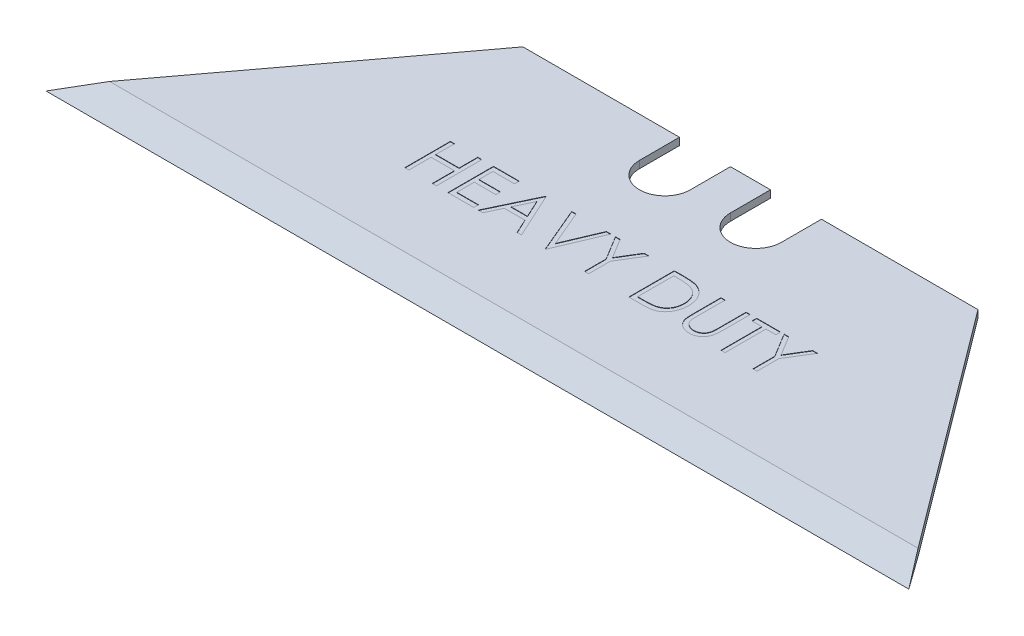
from build123d import *

# Parameters (mm, degrees)
BOSS_EXTRUDE1_DEPTH = 0.254
CUT_EXTRUDE1_DEPTH  = 33.584623434
CUT_EXTRUDE2_DEPTH  = 33.58165337
CUT_EXTRUDE3_DEPTH  = 0.0254


with BuildPart() as part:
    # Sketch1 → Boss-Extrude1 (new, symmetric)
    with BuildSketch(Plane(origin=(0, 0, 0), x_dir=(1, 0, 0), z_dir=(0, 1, 0))):
        Polygon((-15.875, 6.578038674), (-30.099, -12.471961326), (30.099, -12.471961326), (15.875, 6.578038674), align=None)
    extrude(amount=BOSS_EXTRUDE1_DEPTH, both=True)

    # Sketch2 → Cut-Extrude1 (cut, through all)
    with BuildSketch(Plane(origin=(0, 0.254, 0), x_dir=(1, 0, 0), z_dir=(0, 1, 0))):
        with BuildLine():
            Line((-4.953, 3.784038674), (-4.953, 6.578038674))
            Line((-4.953, 6.578038674), (-1.397, 6.578038674))
            Line((-1.397, 6.578038674), (-1.397, 3.784038674))
            ThreePointArc((-1.397, 3.784038674), (-3.175, 2.006038674), (-4.953, 3.784038674))
        make_face()
        with BuildLine():
            Line((1.397, 3.784038674), (1.397, 6.578038674))
            Line((1.397, 6.578038674), (4.953, 6.578038674))
            Line((4.953, 6.578038674), (4.953, 3.784038674))
            ThreePointArc((4.953, 3.784038674), (3.175, 2.006038674), (1.397, 3.784038674))
        make_face()
    extrude(amount=-CUT_EXTRUDE1_DEPTH, mode=Mode.SUBTRACT)

    # Sketch3 → Cut-Extrude2 (cut, symmetric)
    with BuildSketch(Plane(origin=(0, 0, 0), x_dir=(0, 0, -1), z_dir=(1, 0, 0))):
        Polygon((-12.471961326, 0), (-9.931961326, 0.254), (-12.471961326, 0.254), align=None)
    cut_extrude2 = extrude(amount=CUT_EXTRUDE2_DEPTH, both=True, mode=Mode.SUBTRACT)

    # Mirror1: Cut-Extrude2 across plane
    add(cut_extrude2.mirror(Plane.ZX), mode=Mode.SUBTRACT)

    # Sketch4 → Cut-Extrude3 (cut)
    # profile 1 of 9: a face of its own
    with BuildSketch(Plane(origin=(0, 0.254, 0), x_dir=(1, 0, 0), z_dir=(0, 1, 0))):
        Polygon((-12.694002001, -1.667291369), (-12.409066104, -1.667291369), (-12.409066104, -2.969855472), (-10.780860975, -2.969855472), (-10.780860975, -1.667291369), (-10.495925078, -1.667291369), (-10.495925078, -4.842291369), (-10.780860975, -4.842291369), (-10.780860975, -3.295496498), (-12.409066104, -3.295496498), (-12.409066104, -4.842291369), (-12.694002001, -4.842291369), align=None)
    # profile 2 of 9: a face of its own
    with BuildSketch(Plane(origin=(0, 0.254, 0), x_dir=(1, 0, 0), z_dir=(0, 1, 0))):
        Polygon((-9.681822514, -1.667291369), (-7.890796873, -1.667291369), (-7.890796873, -1.992932395), (-9.396886616, -1.992932395), (-9.396886616, -2.969855472), (-7.890796873, -2.969855472), (-7.890796873, -3.295496498), (-9.396886616, -3.295496498), (-9.396886616, -4.516650344), (-7.890796873, -4.516650344), (-7.890796873, -4.842291369), (-9.681822514, -4.842291369), align=None)
    # profile 3 of 9: a face of its own
    with BuildSketch(Plane(origin=(0, 0.254, 0), x_dir=(1, 0, 0), z_dir=(0, 1, 0))):
        Polygon((-6.018360975, -1.667291369), (-4.55297636, -4.842291369), (-4.862716945, -4.842291369), (-5.332097955, -3.824663164), (-6.771405847, -3.824663164), (-7.254143227, -4.842291369), (-7.565155847, -4.842291369), (-6.059066104, -1.667291369), align=None)
        Polygon((-6.041893628, -2.286136522), (-6.616853564, -3.499022139), (-5.482198115, -3.499022139), align=None, mode=Mode.SUBTRACT)
    # profile 4 of 9: a face of its own
    with BuildSketch(Plane(origin=(0, 0.254, 0), x_dir=(1, 0, 0), z_dir=(0, 1, 0))):
        Polygon((-4.227335334, -1.667291369), (-3.922046873, -1.667291369), (-2.86371354, -4.169384719), (-1.805380206, -1.667291369), (-1.500091745, -1.667291369), (-2.843360975, -4.842291369), (-2.884066104, -4.842291369), align=None)
    # profile 5 of 9: a face of its own
    with BuildSketch(Plane(origin=(0, 0.254, 0), x_dir=(1, 0, 0), z_dir=(0, 1, 0))):
        Polygon((-1.174450719, -1.667291369), (-0.848173676, -1.667291369), (-0.013718548, -3.031549182), (0.819464545, -1.667291369), (1.145741589, -1.667291369), (0.128113384, -3.333021538), (0.128113384, -4.842291369), (-0.156822514, -4.842291369), (-0.156822514, -3.333021538), align=None)
    # profile 6 of 9: a face of its own
    with BuildSketch(Plane(origin=(0, 0.254, 0), x_dir=(1, 0, 0), z_dir=(0, 1, 0))):
        with BuildLine():
            Line((2.93676723, -4.842291369), (2.93676723, -1.667291369))
            Line((2.93676723, -1.667291369), (3.577872999, -1.667291369))
            add(Edge.make_bspline(
                [(3.577872999, -1.667291369), (3.633634153, -1.667692844), (3.741364411, -1.66846849), (3.897041417, -1.673386466), (4.041080973, -1.682086389), (4.173009352, -1.694758744), (4.293188737, -1.710318996), (4.401282618, -1.729822935), (4.497849919, -1.752853632), (4.557240054, -1.772489148), (4.585324922, -1.781774543)],
                knots=[0, 0, 0, 0, 1.314313732, 2.53924729, 3.670748893, 4.714932338, 5.66265055, 6.526160246, 7.303039223, 8, 8, 8, 8], degree=3))
            add(Edge.make_bspline(
                [(4.585324922, -1.781774543), (4.622059436, -1.795772397), (4.694695446, -1.823450681), (4.798116193, -1.875662469), (4.895475629, -1.934820068), (4.987295853, -2.001001458), (5.07147946, -2.076080545), (5.151315195, -2.156868044), (5.223537123, -2.246301753), (5.289675363, -2.342526921), (5.349306997, -2.444409997), (5.401140376, -2.551756845), (5.444187927, -2.664022312), (5.479923211, -2.780894197), (5.508086783, -2.902629482), (5.527301821, -3.029369918), (5.539975505, -3.160614611), (5.54124918, -3.249672875), (5.541895435, -3.29486048)],
                knots=[0, 0, 0, 0, 0.984719456, 1.947108742, 2.898477687, 3.838006223, 4.779231079, 5.722358779, 6.681677486, 7.655904652, 8.64651281, 9.637519902, 10.640069247, 11.656948941, 12.698408672, 13.768548281, 14.867775369, 16, 16, 16, 16], degree=3))
            add(Edge.make_bspline(
                [(5.541895435, -3.29486048), (5.541324871, -3.334104604), (5.540200517, -3.411439248), (5.530104637, -3.525413489), (5.515430404, -3.636006514), (5.492711739, -3.742691685), (5.465132316, -3.846403711), (5.429786265, -3.946037247), (5.389295493, -4.042506274), (5.342078817, -4.134506413), (5.290243418, -4.221667758), (5.234615837, -4.303832701), (5.175255406, -4.379828795), (5.111596082, -4.449886179), (5.044460511, -4.51389924), (4.973409154, -4.572402711), (4.898258672, -4.624251871), (4.819345659, -4.671484176), (4.734368028, -4.712686927), (4.641716206, -4.747548436), (4.540995066, -4.776437866), (4.432451834, -4.800541464), (4.315898965, -4.819661589), (4.191222188, -4.832476245), (4.058613061, -4.84114212), (3.967554728, -4.841900848), (3.920686501, -4.842291369)],
                knots=[0, 0, 0, 0, 1.105936401, 2.179363191, 3.223086493, 4.248585256, 5.251745608, 6.245858792, 7.225916811, 8.198733463, 9.158002045, 10.082870192, 10.993790845, 11.873723703, 12.748670949, 13.606408763, 14.465103618, 15.319838547, 16.196477973, 17.123216899, 18.106603292, 19.147568657, 20.255746949, 21.433717677, 22.679120308, 24, 24, 24, 24], degree=3))
            Line((3.920686501, -4.842291369), (2.93676723, -4.842291369))
        make_face()
        with BuildLine():
            Line((3.221703127, -4.516650344), (3.586141228, -4.516650344))
            add(Edge.make_bspline(
                [(3.586141228, -4.516650344), (3.638509107, -4.516425285), (3.739231717, -4.515992414), (3.884064329, -4.512194023), (4.016397782, -4.505987408), (4.136250865, -4.497301445), (4.243555909, -4.485809201), (4.338537167, -4.472995896), (4.420883295, -4.457032495), (4.470712141, -4.442562696), (4.493738384, -4.435876105)],
                knots=[0, 0, 0, 0, 1.375205317, 2.645023457, 3.804390687, 4.853969522, 5.800190428, 6.637939096, 7.370582563, 8, 8, 8, 8], degree=3))
            add(Edge.make_bspline(
                [(4.493738384, -4.435876105), (4.522720112, -4.425669334), (4.579991341, -4.405499581), (4.662433468, -4.368707989), (4.73932018, -4.325126968), (4.811991417, -4.276683477), (4.879416311, -4.221668889), (4.942393903, -4.161279492), (5.000797394, -4.095207947), (5.054023373, -4.023536257), (5.101655906, -3.946710514), (5.142904807, -3.865486001), (5.179055839, -3.78075268), (5.207429991, -3.691209372), (5.229669128, -3.597656583), (5.245421381, -3.500087732), (5.255231881, -3.398521041), (5.256376194, -3.329440185), (5.256959537, -3.294224462)],
                knots=[0, 0, 0, 0, 0.998632004, 1.973411704, 2.929992603, 3.868527914, 4.809262121, 5.754881198, 6.702106254, 7.672490631, 8.653608572, 9.636854334, 10.631411391, 11.644891563, 12.686317036, 13.754757253, 14.855430412, 16, 16, 16, 16], degree=3))
            add(Edge.make_bspline(
                [(5.256959537, -3.294224462), (5.256493912, -3.257091948), (5.255579188, -3.184144795), (5.244081778, -3.077110379), (5.227280081, -2.974167217), (5.202983452, -2.875308426), (5.172021869, -2.780341135), (5.133382444, -2.689790579), (5.089234868, -2.602700448), (5.036708269, -2.521080845), (4.979181267, -2.443889239), (4.915338476, -2.373172994), (4.846194198, -2.308771021), (4.772502585, -2.249680359), (4.692186788, -2.19827831), (4.607138797, -2.15229825), (4.516110938, -2.113276691), (4.45278085, -2.092522294), (4.420596356, -2.081974863)],
                knots=[0, 0, 0, 0, 1.122418816, 2.205001699, 3.251619955, 4.274784885, 5.280384055, 6.268708349, 7.249350384, 8.229342522, 9.199999885, 10.157847722, 11.105861043, 12.055065948, 13.010012805, 13.98527497, 14.976112212, 16, 16, 16, 16], degree=3))
            add(Edge.make_bspline(
                [(4.420596356, -2.081974863), (4.393970674, -2.074612103), (4.337357167, -2.058956857), (4.244974224, -2.041879554), (4.14100191, -2.026816902), (4.02497861, -2.014064252), (3.897036579, -2.00491361), (3.757077419, -1.998045346), (3.605040635, -1.993412901), (3.499646479, -1.993096574), (3.444945315, -1.992932395)],
                knots=[0, 0, 0, 0, 0.674548936, 1.434276114, 2.292660221, 3.240891867, 4.284742987, 5.42552168, 6.663806718, 8, 8, 8, 8], degree=3))
            Line((3.444945315, -1.992932395), (3.221703127, -1.992932395))
            Line((3.221703127, -1.992932395), (3.221703127, -4.516650344))
        make_face(mode=Mode.SUBTRACT)
    # profile 7 of 9: a face of its own
    with BuildSketch(Plane(origin=(0, 0.254, 0), x_dir=(1, 0, 0), z_dir=(0, 1, 0))):
        with BuildLine():
            Line((6.193177486, -1.667291369), (6.478113384, -1.667291369))
            Line((6.478113384, -1.667291369), (6.478113384, -3.569620095))
            add(Edge.make_bspline(
                [(6.478113384, -3.569620095), (6.47807098, -3.596544763), (6.477990512, -3.647638959), (6.478528007, -3.72036306), (6.480033291, -3.785017363), (6.480982307, -3.841851085), (6.483093531, -3.890603434), (6.484815331, -3.931538538), (6.487029265, -3.964462564), (6.489690021, -3.98367669), (6.490833736, -3.991935801)],
                knots=[0, 0, 0, 0, 1.528628734, 2.90083645, 4.128790002, 5.200304208, 6.127813768, 6.898992206, 7.526736466, 8, 8, 8, 8], degree=3))
            add(Edge.make_bspline(
                [(6.490833736, -3.991935801), (6.495530431, -4.021732507), (6.504659178, -4.079646983), (6.527924107, -4.162113782), (6.560415697, -4.236437319), (6.5989176, -4.304936847), (6.649656469, -4.365705767), (6.710438247, -4.421687052), (6.78407808, -4.470647189), (6.865957344, -4.515415425), (6.954208952, -4.551397321), (7.044389173, -4.578605587), (7.135142446, -4.595187161), (7.195899396, -4.597107164), (7.226070114, -4.5980606)],
                knots=[0, 0, 0, 0, 1.035780045, 2.013197591, 2.933192213, 3.817615948, 4.702609284, 5.640816605, 6.646850145, 7.73207398, 8.84249596, 9.914020372, 10.964143139, 12, 12, 12, 12], degree=3))
            add(Edge.make_bspline(
                [(7.226070114, -4.5980606), (7.251972436, -4.597086465), (7.303627474, -4.59514382), (7.380377594, -4.583113807), (7.455126263, -4.56143258), (7.528242595, -4.533456513), (7.59677813, -4.496492627), (7.66077111, -4.453792651), (7.717888393, -4.403708499), (7.770011005, -4.348281758), (7.81539984, -4.285743511), (7.854743661, -4.217455486), (7.886970755, -4.142390007), (7.902885238, -4.089635638), (7.9110611, -4.062533757)],
                knots=[0, 0, 0, 0, 0.994687771, 1.983630487, 2.973142513, 3.978332533, 4.983357753, 5.956394766, 6.925816176, 7.893390482, 8.871859704, 9.88551698, 10.913711441, 12, 12, 12, 12], degree=3))
            add(Edge.make_bspline(
                [(7.9110611, -4.062533757), (7.913782642, -4.051331836), (7.919847335, -4.026369442), (7.925514297, -3.984167985), (7.931416645, -3.934375491), (7.935512005, -3.876634204), (7.939504541, -3.811137607), (7.941893114, -3.737544502), (7.942997137, -3.656122116), (7.94332614, -3.599301262), (7.943497999, -3.569620095)],
                knots=[0, 0, 0, 0, 0.558680831, 1.244966039, 2.062412453, 2.990489873, 4.051219941, 5.244515665, 6.560634259, 8, 8, 8, 8], degree=3))
            Line((7.943497999, -3.569620095), (7.943497999, -1.667291369))
            Line((7.943497999, -1.667291369), (8.228433896, -1.667291369))
            Line((8.228433896, -1.667291369), (8.228433896, -3.584884519))
            add(Edge.make_bspline(
                [(8.228433896, -3.584884519), (8.228203373, -3.619445191), (8.227753492, -3.686892444), (8.223852255, -3.785726891), (8.217631977, -3.87948281), (8.208843497, -3.968172803), (8.197198501, -4.051479505), (8.184248837, -4.130133116), (8.167757403, -4.203569045), (8.148495675, -4.272359881), (8.126476099, -4.337842454), (8.097954486, -4.399989554), (8.065819404, -4.460690474), (8.027706112, -4.519027116), (7.984878643, -4.575257775), (7.936390333, -4.629041436), (7.883844844, -4.68123757), (7.826368672, -4.73050728), (7.764909267, -4.775690866), (7.699649448, -4.815421701), (7.631090521, -4.849007411), (7.5594107, -4.876653428), (7.484579394, -4.897440243), (7.406594718, -4.912929849), (7.325279164, -4.921731219), (7.269975512, -4.923039255), (7.241970555, -4.923701626)],
                knots=[0, 0, 0, 0, 1.316592851, 2.569410997, 3.76748051, 4.895814652, 5.963796859, 6.97159953, 7.931736103, 8.829262218, 9.692595152, 10.560224239, 11.431080259, 12.30701507, 13.211635791, 14.121146779, 15.063487852, 16.031507147, 17.00238618, 17.966455255, 18.938106653, 19.907068911, 20.888905087, 21.893141452, 22.933117798, 24, 24, 24, 24], degree=3))
            add(Edge.make_bspline(
                [(7.241970555, -4.923701626), (7.211427869, -4.922989732), (7.151503229, -4.921592998), (7.063203696, -4.913589503), (6.978554389, -4.898514245), (6.896661272, -4.879319154), (6.818639279, -4.852845335), (6.743443083, -4.821913464), (6.672360565, -4.783924807), (6.604238555, -4.741657943), (6.540897526, -4.694101307), (6.482752025, -4.642267006), (6.429706057, -4.586985378), (6.382653739, -4.527657904), (6.340815508, -4.464745998), (6.304774529, -4.398071688), (6.273828943, -4.327660787), (6.257857272, -4.278717526), (6.249783055, -4.253975063)],
                knots=[0, 0, 0, 0, 1.13879206, 2.234305948, 3.301075583, 4.341971843, 5.366689343, 6.369221514, 7.369726634, 8.367512178, 9.355451585, 10.318319045, 11.268648973, 12.207971039, 13.137398894, 14.081662264, 15.030215811, 16, 16, 16, 16], degree=3))
            add(Edge.make_bspline(
                [(6.249783055, -4.253975063), (6.245086633, -4.237072657), (6.234899989, -4.20041096), (6.223991326, -4.139735359), (6.214820945, -4.069871827), (6.206198046, -3.99081558), (6.201109919, -3.902505344), (6.1966491, -3.804979399), (6.19314606, -3.69811982), (6.193166718, -3.623684652), (6.193177486, -3.584884519)],
                knots=[0, 0, 0, 0, 0.625038921, 1.35572334, 2.194682327, 3.136881307, 4.189498639, 5.346923369, 6.617055217, 8, 8, 8, 8], degree=3))
            Line((6.193177486, -3.584884519), (6.193177486, -1.667291369))
        make_face()
    # profile 8 of 9: a face of its own
    with BuildSketch(Plane(origin=(0, 0.254, 0), x_dir=(1, 0, 0), z_dir=(0, 1, 0))):
        Polygon((8.676190307, -1.992932395), (8.676190307, -1.667291369), (10.345100563, -1.667291369), (10.345100563, -1.992932395), (9.653113384, -1.992932395), (9.653113384, -4.842291369), (9.368177486, -4.842291369), (9.368177486, -1.992932395), align=None)
    # profile 9 of 9: a face of its own
    with BuildSketch(Plane(origin=(0, 0.254, 0), x_dir=(1, 0, 0), z_dir=(0, 1, 0))):
        Polygon((10.589331332, -1.667291369), (10.915608376, -1.667291369), (11.750063504, -3.031549182), (12.583246597, -1.667291369), (12.90952364, -1.667291369), (11.891895435, -3.333021538), (11.891895435, -4.842291369), (11.606959537, -4.842291369), (11.606959537, -3.333021538), align=None)
    extrude(amount=-CUT_EXTRUDE3_DEPTH, mode=Mode.SUBTRACT)


solid = part.part
